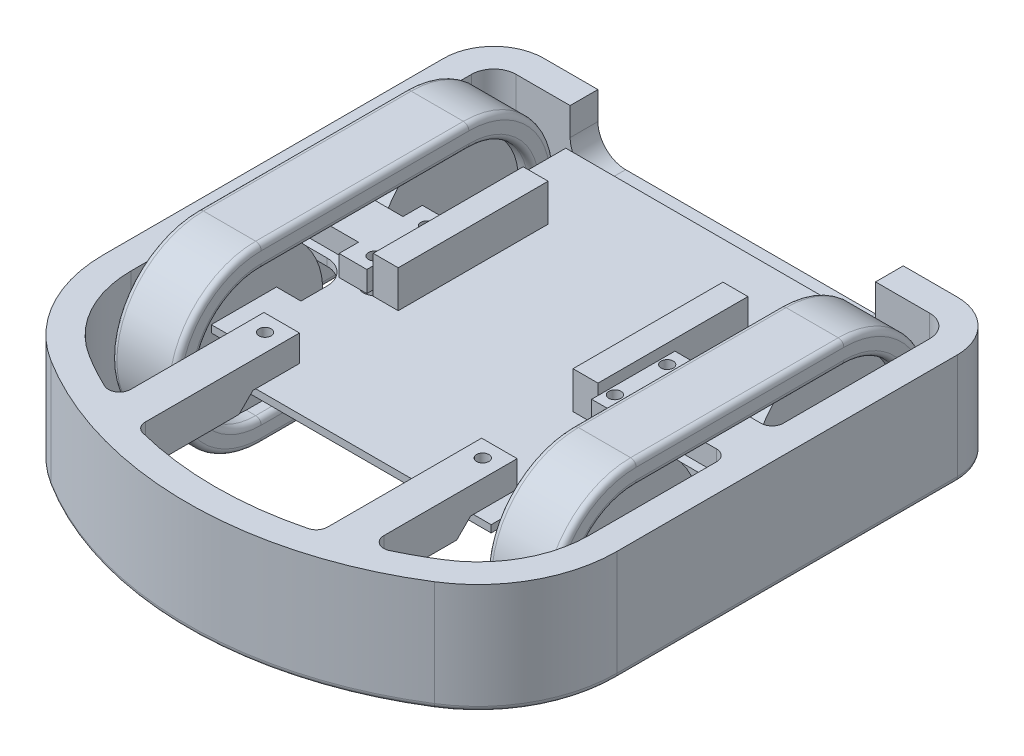
from build123d import *

# Parameters (mm, degrees)
SKETCH1_W                = 93.98
SKETCH1_H                = 83.1088
BOSS_EXTRUDE1_DEPTH      = 1.651
CUT_EXTRUDE3_DEPTH       = 63.749932752
SKETCH3_W                = 66.04
SKETCH3_H                = 60.579
BOSS_EXTRUDE2_DEPTH      = 19.05
CUT_EXTRUDE4_DEPTH       = 67.055731472
CUT_EXTRUDE4_DEPTH_BACK  = 67.055731472
SKETCH4_R                = 1.0795
SKETCH5_W                = 5.715
SKETCH5_H                = 34.29
BOSS_EXTRUDE3_DEPTH      = 8.509
SKETCH8_R                = 17.526
BOSS_EXTRUDE4_DEPTH      = 3.81
BOSS_EXTRUDE4_2_DEPTH    = 3.81
BOSS_EXTRUDE5_DEPTH      = 7.239
FILLET1_R                = 1.27
BOSS_EXTRUDE6_DEPTH      = 12.7
BOSS_EXTRUDE6_DEPTH_BACK = 12.7
CUT_EXTRUDE5_DEPTH       = 6.35
BOSS_EXTRUDE7_DEPTH      = 6.0452
BOSS_EXTRUDE7_DEPTH_BACK = 3.175
SKETCH12_R               = 1.397
CUT_EXTRUDE6_DEPTH       = 31.75
BOSS_EXTRUDE9_START      = 4.7752
SKETCH18_R               = 1.0795
BOSS_EXTRUDE9_DEPTH      = 4.7752
BOSS_EXTRUDE11_REACH     = 103.517
SKETCH19_R               = 1.0795
FILLET2_R                = 2.54
FILLET3_R                = 1.27
CUT_EXTRUDE7_START       = -6.0452
SKETCH20_R               = 1.397
CUT_EXTRUDE7_DEPTH       = 6.0452


with BuildPart() as part:
    # Sketch1 → Boss-Extrude1 (new body)
    with BuildSketch(Plane(origin=(0, 0, 0), x_dir=(1, 0, 0), z_dir=(0, 1, 0))):
        Rectangle(SKETCH1_W, SKETCH1_H)
    extrude(amount=BOSS_EXTRUDE1_DEPTH)

    # Sketch2 → Cut-Extrude3 (cut, through all)
    with BuildSketch(Plane(origin=(0, 0, 0), x_dir=(1, 0, 0), z_dir=(0, 1, 0))):
        with BuildLine():
            Line((33.02, 41.5544), (33.02, 9.6012))
            ThreePointArc((33.02, 9.6012), (34.656687307, 5.649887307), (38.608, 4.0132))
            Line((38.608, 4.0132), (46.99, 4.0132))
            Line((46.99, 4.0132), (46.99, 41.5544))
            Line((46.99, 41.5544), (33.02, 41.5544))
        make_face()
        with BuildLine():
            Line((38.608, -7.493), (46.99, -7.493))
            Line((46.99, -7.493), (46.99, -41.5544))
            Line((46.99, -41.5544), (33.02, -41.5544))
            Line((33.02, -41.5544), (33.02, -33.9344))
            Line((33.02, -33.9344), (38.608, -33.9344))
            Line((38.608, -33.9344), (38.608, -19.0246))
            Line((38.608, -19.0246), (33.02, -19.0246))
            Line((33.02, -19.0246), (33.02, -13.081))
            ThreePointArc((33.02, -13.081), (34.656687307, -9.129687307), (38.608, -7.493))
        make_face()
        with BuildLine():
            Line((-46.99, 4.0132), (-46.99, 41.5544))
            Line((-46.99, 41.5544), (-33.02, 41.5544))
            Line((-33.02, 41.5544), (-33.02, 9.6012))
            ThreePointArc((-33.02, 9.6012), (-34.656687307, 5.649887307), (-38.608, 4.0132))
            Line((-38.608, 4.0132), (-46.99, 4.0132))
        make_face()
        with BuildLine():
            Line((-46.99, -41.5544), (-46.99, -7.493))
            Line((-46.99, -7.493), (-38.608, -7.493))
            ThreePointArc((-38.608, -7.493), (-34.656687307, -9.129687307), (-33.02, -13.081))
            Line((-33.02, -13.081), (-33.02, -19.0246))
            Line((-33.02, -19.0246), (-38.608, -19.0246))
            Line((-38.608, -19.0246), (-38.608, -33.9344))
            Line((-38.608, -33.9344), (-33.02, -33.9344))
            Line((-33.02, -33.9344), (-33.02, -41.5544))
            Line((-33.02, -41.5544), (-46.99, -41.5544))
        make_face()
    extrude(amount=CUT_EXTRUDE3_DEPTH, mode=Mode.SUBTRACT)

    # Sketch3 → Boss-Extrude2 (add)
    with BuildSketch(Plane.XZ):
        with Locations((0, -11.2649)):
            Rectangle(SKETCH3_W, SKETCH3_H)
    extrude(amount=BOSS_EXTRUDE2_DEPTH)

    # Sketch4 → Cut-Extrude4 (cut, two sides: drawn at the far end of the back side and taken through both)
    with BuildSketch(Plane(origin=(0, 1.651, 0), x_dir=(1, 0, 0), z_dir=(0, 1, 0)).offset(-CUT_EXTRUDE4_DEPTH_BACK)):
        with Locations(Location((24.892, -35.3568, 0), (0, 0, 270))):
            Circle(SKETCH4_R)
        with Locations(Location((27.4828, -7.7216, 0), (0, 0, 270))):
            Circle(SKETCH4_R)
        with Locations(Location((27.4828, 4.2418, 0), (0, 0, 270))):
            Circle(SKETCH4_R)
        with Locations(Location((-24.892, -35.3568, 0), (0, 0, 270))):
            Circle(SKETCH4_R)
        with Locations(Location((-27.4828, -7.7216, 0), (0, 0, 270))):
            Circle(SKETCH4_R)
        with Locations(Location((-27.4828, 4.2418, 0), (0, 0, 270))):
            Circle(SKETCH4_R)
    extrude(amount=CUT_EXTRUDE4_DEPTH + CUT_EXTRUDE4_DEPTH_BACK, mode=Mode.SUBTRACT)

    # Sketch5 → Boss-Extrude3 (add)
    with BuildSketch(Plane(origin=(0, 1.651, 0), x_dir=(1, 0, 0), z_dir=(0, 1, 0))):
        with Locations((22.8473, 7.3406)):
            Rectangle(SKETCH5_W, SKETCH5_H)
        with Locations((-22.8473, 7.3406)):
            Rectangle(SKETCH5_W, SKETCH5_H)
    extrude(amount=BOSS_EXTRUDE3_DEPTH)


with BuildPart() as body_2:
    # Sketch8 → Boss-Extrude4 (new, symmetric)
    with BuildSketch(Plane(origin=(42.8752, 0, 0), x_dir=(0, 0, -1), z_dir=(1, 0, 0))):
        with Locations(Location((-25.4889, -5.0038, 0), (0, 0, 180))):
            Circle(SKETCH8_R)
    extrude(amount=BOSS_EXTRUDE4_DEPTH, both=True)


with BuildPart() as body_3:
    # Sketch8 → Boss-Extrude4 2 (new, symmetric)
    with BuildSketch(Plane(origin=(42.8752, 0, 0), x_dir=(0, 0, -1), z_dir=(1, 0, 0))):
        with Locations(Location((22.0091, -5.0038, 0), (0, 0, 180))):
            Circle(SKETCH8_R)
    extrude(amount=BOSS_EXTRUDE4_2_DEPTH, both=True)


with BuildPart() as body_4:
    # Sketch9 → Boss-Extrude5 (new, symmetric)
    with BuildSketch(Plane(origin=(42.8752, 0, 0), x_dir=(0, 0, -1), z_dir=(1, 0, 0))):
        with BuildLine():
            Line((-25.4889, 14.8082), (22.0091, 14.8082))
            ThreePointArc((22.0091, 14.8082), (41.8211, -5.0038), (22.0091, -24.8158))
            Line((22.0091, -24.8158), (-25.4889, -24.8158))
            ThreePointArc((-25.4889, -24.8158), (-45.3009, -5.0038), (-25.4889, 14.8082))
        make_face()
        with BuildLine():
            Line((-25.4889, 9.7282), (22.0091, 9.7282))
            ThreePointArc((22.0091, 9.7282), (36.7411, -5.0038), (22.0091, -19.7358))
            Line((22.0091, -19.7358), (-25.4889, -19.7358))
            ThreePointArc((-25.4889, -19.7358), (-40.2209, -5.0038), (-25.4889, 9.7282))
        make_face(mode=Mode.SUBTRACT)
    extrude(amount=BOSS_EXTRUDE5_DEPTH, both=True)

    # Fillet1
    fillet1_edges = [body_4.edges().sort_by_distance(p)[0] for p in [
        (50.1142, -5.0038, -41.8211),
        (50.1142, 14.8082, 1.7399),
        (35.6362, -5.0038, 40.2209),
        (35.6362, -19.7358, 1.7399),
        (35.6362, -5.0038, -36.7411),
        (35.6362, 9.7282, 1.7399),
        (50.1142, -5.0038, 40.2209),
        (50.1142, -19.7358, 1.7399),
        (50.1142, -5.0038, -36.7411),
        (50.1142, 9.7282, 1.7399),
        (50.1142, -5.0038, 45.3009),
        (35.6362, 14.8082, 1.7399),
        (35.6362, -5.0038, -41.8211),
        (35.6362, -24.8158, 1.7399),
        (35.6362, -5.0038, 45.3009),
        (50.1142, -24.8158, 1.7399),
    ]]
    fillet(fillet1_edges, radius=FILLET1_R)


with BuildPart() as body_5:
    # Mirror9: mirrored copy
    add(body_4.part.mirror(Plane(origin=(0, 0, 0), x_dir=(0, 0, 1), z_dir=(1, 0, 0))))


with BuildPart() as body_6:
    # Mirror9 2: mirrored copy
    add(body_2.part.mirror(Plane(origin=(0, 0, 0), x_dir=(0, 0, 1), z_dir=(1, 0, 0))))


with BuildPart() as body_7:
    # Mirror9 3: mirrored copy
    add(body_3.part.mirror(Plane(origin=(0, 0, 0), x_dir=(0, 0, 1), z_dir=(1, 0, 0))))


with BuildPart() as body_8:
    # Sketch10 → Boss-Extrude6 (new, two sides: drawn at the far end of the back side and taken through both)
    with BuildSketch(Plane(origin=(0, -5.0038, 0), x_dir=(1, 0, 0), z_dir=(0, 1, 0)).offset(-BOSS_EXTRUDE6_DEPTH_BACK)):
        with BuildLine():
            Line((58.7375, -38.503277876), (58.7375, 39.37))
            ThreePointArc((58.7375, 39.37), (55.389730509, 47.452230509), (47.3075, 50.8))
            Line((47.3075, 50.8), (-47.3075, 50.8))
            ThreePointArc((-47.3075, 50.8), (-55.389730509, 47.452230509), (-58.7375, 39.37))
            Line((-58.7375, 39.37), (-58.7375, -38.503277876))
            ThreePointArc((-58.7375, -38.503277876), (-54.76875, -53.874180531), (-43.8546875, -65.402357522))
            ThreePointArc((-43.8546875, -65.402357522), (0, -78.014750441), (43.8546875, -65.402357522))
            ThreePointArc((43.8546875, -65.402357522), (54.76875, -53.874180531), (58.7375, -38.503277876))
        make_face()
        with BuildLine():
            Line((52.3875, -38.503277876), (52.3875, 39.37))
            ThreePointArc((52.3875, 39.37), (50.899602448, 42.962102448), (47.3075, 44.45))
            Line((47.3075, 44.45), (-47.3075, 44.45))
            ThreePointArc((-47.3075, 44.45), (-50.899602448, 42.962102448), (-52.3875, 39.37))
            Line((-52.3875, 39.37), (-52.3875, -38.503277876))
            ThreePointArc((-52.3875, -38.503277876), (-49.2125, -50.8), (-40.48125, -60.022541593))
            ThreePointArc((-40.48125, -60.022541593), (0, -71.664750441), (40.48125, -60.022541593))
            ThreePointArc((40.48125, -60.022541593), (49.2125, -50.8), (52.3875, -38.503277876))
        make_face(mode=Mode.SUBTRACT)
    extrude(amount=BOSS_EXTRUDE6_DEPTH + BOSS_EXTRUDE6_DEPTH_BACK)

    # Sketch11 → Cut-Extrude5 (cut)
    with BuildSketch(Plane(origin=(0, 0, -50.8), x_dir=(-1, 0, 0), z_dir=(0, 0, -1))):
        with BuildLine():
            Line((-34.925, 7.6962), (34.925, 7.6962))
            Line((34.925, 7.6962), (34.925, 1.3462))
            ThreePointArc((34.925, 1.3462), (33.065128061, -3.143928061), (28.575, -5.0038))
            Line((28.575, -5.0038), (-28.575, -5.0038))
            ThreePointArc((-28.575, -5.0038), (-33.065128061, -3.143928061), (-34.925, 1.3462))
            Line((-34.925, 1.3462), (-34.925, 7.6962))
        make_face()
    extrude(amount=-CUT_EXTRUDE5_DEPTH, mode=Mode.SUBTRACT)

    # Sketch12 → Boss-Extrude7 (add, two sides: drawn at the far end of the back side and taken through both)
    # profile 1 of 2: a face of its own
    with BuildSketch(Plane(origin=(0, 1.651, 0), x_dir=(1, 0, 0), z_dir=(0, 1, 0)).offset(-BOSS_EXTRUDE7_DEPTH_BACK)):
        with BuildLine():
            Line((-28.956, -31.5468), (-20.828, -31.5468))
            Line((-20.828, -31.5468), (-20.828, -68.76300701))
            ThreePointArc((-20.828, -68.76300701), (-24.931741132, -67.470641062), (-28.956, -65.948720704))
            Line((-28.956, -65.948720704), (-28.956, -31.5468))
        make_face()
        with Locations(Location((-24.892, -35.3568, 0), (0, 0, 270))):
            Circle(SKETCH12_R, mode=Mode.SUBTRACT)
    # profile 2 of 2: a face of its own
    with BuildSketch(Plane(origin=(0, 1.651, 0), x_dir=(1, 0, 0), z_dir=(0, 1, 0)).offset(-BOSS_EXTRUDE7_DEPTH_BACK)):
        with BuildLine():
            Line((20.828, -31.5468), (20.828, -68.76300701))
            ThreePointArc((20.828, -68.76300701), (24.931741132, -67.470641062), (28.956, -65.948720704))
            Line((28.956, -65.948720704), (28.956, -31.5468))
            Line((28.956, -31.5468), (20.828, -31.5468))
        make_face()
        with Locations(Location((24.892, -35.3568, 0), (0, 0, 270))):
            Circle(SKETCH12_R, mode=Mode.SUBTRACT)
    extrude(amount=BOSS_EXTRUDE7_DEPTH + BOSS_EXTRUDE7_DEPTH_BACK)

    # Sketch16 → Cut-Extrude6 (cut, symmetric)
    with BuildSketch(Plane(origin=(0, 0, 0), x_dir=(0, 0, -1), z_dir=(1, 0, 0))):
        Polygon((-42.199111168, 1.649648887), (-45.374111168, -1.525351113), (-31.531111168, -1.525351113), (-31.531111168, 1.649648887), align=None)
    extrude(amount=CUT_EXTRUDE6_DEPTH, both=True, mode=Mode.SUBTRACT)

    # Sketch18 → Boss-Extrude9 (add)
    # profile 1 of 2: a face of its own
    with BuildSketch(Plane(origin=(0, 2.921, 0), x_dir=(1, 0, 0), z_dir=(0, 1, 0)).offset(BOSS_EXTRUDE9_START)):
        Polygon((-25.7048, 7.7851), (-32.0548, 7.7851), (-32.0548, 3.3401), (-52.3875, 3.3401), (-52.3875, -6.8199), (-32.0548, -6.8199), (-32.0548, -11.2649), (-25.7048, -11.2649), align=None)
        with Locations(Location((-27.4828, -7.7216, 0), (0, 0, 270))):
            Circle(SKETCH18_R, mode=Mode.SUBTRACT)
        with Locations(Location((-27.4828, 4.2418, 0), (0, 0, 270))):
            Circle(SKETCH18_R, mode=Mode.SUBTRACT)
    # profile 2 of 2: a face of its own
    with BuildSketch(Plane(origin=(0, 2.921, 0), x_dir=(1, 0, 0), z_dir=(0, 1, 0)).offset(BOSS_EXTRUDE9_START)):
        Polygon((32.0548, -6.8199), (32.0548, -11.2649), (25.7048, -11.2649), (25.7048, 7.7851), (32.0548, 7.7851), (32.0548, 3.3401), (52.3875, 3.3401), (52.3875, -6.8199), align=None)
        with Locations(Location((27.4828, 4.2418, 0), (0, 0, 270))):
            Circle(SKETCH18_R, mode=Mode.SUBTRACT)
        with Locations(Location((27.4828, -7.7216, 0), (0, 0, 270))):
            Circle(SKETCH18_R, mode=Mode.SUBTRACT)
    extrude(amount=-BOSS_EXTRUDE9_DEPTH)


    # Sketch19 → Boss-Extrude11 (add, up to next)
    with BuildSketch(Plane(origin=(0, 2.921, 0), x_dir=(1, 0, 0), z_dir=(0, 1, 0)), mode=Mode.PRIVATE) as boss_extrude11_sk1:
        with BuildLine():
            Line((-25.7048, -9.535522821), (-25.7048, -5.907677179))
            ThreePointArc((-25.7048, -5.907677179), (-30.0228, -7.7216), (-25.7048, -9.535522821))
        make_face()
        with Locations(Location((-27.4828, -7.7216, 0), (0, 0, 270))):
            Circle(SKETCH19_R, mode=Mode.SUBTRACT)
    boss_extrude11_tool1 = extrude(boss_extrude11_sk1.sketch, amount=-BOSS_EXTRUDE11_REACH, mode=Mode.PRIVATE) - part.part
    # Sketch19 → Boss-Extrude11 (add, up to next)
    with BuildSketch(Plane(origin=(0, 2.921, 0), x_dir=(1, 0, 0), z_dir=(0, 1, 0)), mode=Mode.PRIVATE) as boss_extrude11_sk2:
        with BuildLine():
            Line((-25.7048, 2.427877179), (-25.7048, 6.055722821))
            ThreePointArc((-25.7048, 6.055722821), (-30.0228, 4.2418), (-25.7048, 2.427877179))
        make_face()
        with Locations(Location((-27.4828, 4.2418, 0), (0, 0, 270))):
            Circle(SKETCH19_R, mode=Mode.SUBTRACT)
    boss_extrude11_tool2 = extrude(boss_extrude11_sk2.sketch, amount=-BOSS_EXTRUDE11_REACH, mode=Mode.PRIVATE) - part.part
    # Sketch19 → Boss-Extrude11 (add, up to next)
    with BuildSketch(Plane(origin=(0, 2.921, 0), x_dir=(1, 0, 0), z_dir=(0, 1, 0)), mode=Mode.PRIVATE) as boss_extrude11_sk3:
        with BuildLine():
            Line((25.7048, 2.427877179), (25.7048, 6.055722821))
            ThreePointArc((25.7048, 6.055722821), (30.0228, 4.2418), (25.7048, 2.427877179))
        make_face()
        with Locations(Location((27.4828, 4.2418, 0), (0, 0, 270))):
            Circle(SKETCH19_R, mode=Mode.SUBTRACT)
    boss_extrude11_tool3 = extrude(boss_extrude11_sk3.sketch, amount=-BOSS_EXTRUDE11_REACH, mode=Mode.PRIVATE) - part.part
    # Sketch19 → Boss-Extrude11 (add, up to next)
    with BuildSketch(Plane(origin=(0, 2.921, 0), x_dir=(1, 0, 0), z_dir=(0, 1, 0)), mode=Mode.PRIVATE) as boss_extrude11_sk4:
        with BuildLine():
            Line((25.7048, -9.535522821), (25.7048, -5.907677179))
            ThreePointArc((25.7048, -5.907677179), (30.0228, -7.7216), (25.7048, -9.535522821))
        make_face()
        with Locations(Location((27.4828, -7.7216, 0), (0, 0, 270))):
            Circle(SKETCH19_R, mode=Mode.SUBTRACT)
    boss_extrude11_tool4 = extrude(boss_extrude11_sk4.sketch, amount=-BOSS_EXTRUDE11_REACH, mode=Mode.PRIVATE) - part.part
    add(boss_extrude11_tool1.solids().sort_by_distance((-25.771472, 2.921, 7.7216))[0])
    add(boss_extrude11_tool2.solids().sort_by_distance((-29.956128, 2.921, -4.2418))[0])
    add(boss_extrude11_tool3.solids().sort_by_distance((25.771472, 2.921, -4.2418))[0])
    add(boss_extrude11_tool4.solids().sort_by_distance((25.771472, 2.921, 7.7216))[0])

    # Fillet2
    fillet2_edges = [body_8.edges().sort_by_distance(p)[0] for p in [
        (-28.956, 3.0861, 65.948720704),
        (-20.828, 3.0861, 68.76300701),
        (-24.931741132, -1.524, 67.470641062),
        (28.956, 3.0861, 65.948720704),
        (24.931741132, -1.524, 67.470641062),
        (20.828, 3.0861, 68.76300701),
        (-52.3875, 5.3086, 6.8199),
        (-52.3875, 5.3086, -3.3401),
        (-52.3875, 2.921, 1.7399),
        (52.3875, 5.3086, -3.3401),
        (52.3875, 5.3086, 6.8199),
        (52.3875, 2.921, 1.7399),
    ]]
    fillet(fillet2_edges, radius=FILLET2_R)

    # Fillet3
    fillet3_edges = [body_8.edges().sort_by_distance(p)[0] for p in [
        (0, -17.7038, 71.664750441),
        (-49.2125, -17.7038, 50.8),
        (-52.3875, -17.7038, -0.433361062),
        (-50.899602448, -17.7038, -42.962102448),
        (0, -17.7038, -44.45),
        (50.899602448, -17.7038, -42.962102448),
        (52.3875, -17.7038, -0.433361062),
        (54.76875, -17.7038, 53.874180531),
        (58.7375, -17.7038, -0.433361062),
        (55.389730509, -17.7038, -47.452230509),
        (0, -17.7038, -50.8),
        (-55.389730509, -17.7038, -47.452230509),
        (-58.7375, -17.7038, -0.433361062),
        (49.2125, -17.7038, 50.8),
        (-54.76875, -17.7038, 53.874180531),
        (0, -17.7038, 78.014750441),
    ]]
    fillet(fillet3_edges, radius=FILLET3_R)

    # Sketch20 → Cut-Extrude7 (cut)
    with BuildSketch(Plane(origin=(0, 7.6962, 0), x_dir=(1, 0, 0), z_dir=(0, 1, 0)).offset(CUT_EXTRUDE7_START)):
        with Locations(Location((-27.4828, 4.2418, 0), (0, 0, 270))):
            Circle(SKETCH20_R)
        with Locations(Location((-27.4828, -7.7216, 0), (0, 0, 270))):
            Circle(SKETCH20_R)
        with Locations(Location((27.4828, -7.7216, 0), (0, 0, 270))):
            Circle(SKETCH20_R)
        with Locations(Location((27.4828, 4.2418, 0), (0, 0, 270))):
            Circle(SKETCH20_R)
    extrude(amount=CUT_EXTRUDE7_DEPTH, mode=Mode.SUBTRACT)


solid = Compound([part.part, body_2.part, body_3.part, body_4.part, body_5.part, body_6.part, body_7.part, body_8.part])
